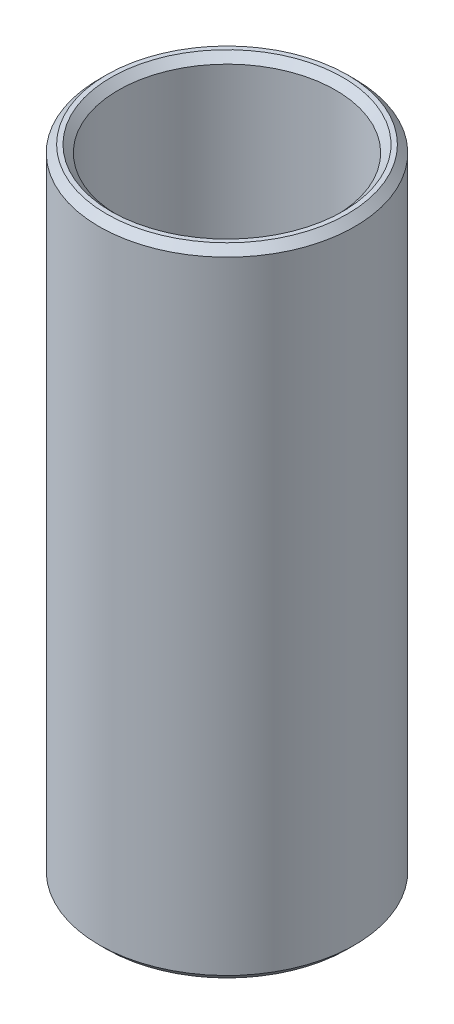
from build123d import *

# Parameters (mm, degrees)
SKETCH1_R           = 55
BOSS_EXTRUDE1_DEPTH = 273.943988282
SKETCH2_R           = 46.760833803
CUT_EXTRUDE1_DEPTH  = 285.772380536
CHAMFER1_SIZE       = 3.151265274


with BuildPart() as part:
    # Sketch1 → Boss-Extrude1 (new body)
    with BuildSketch(Plane(origin=(0, 0, 0), x_dir=(1, 0, 0), z_dir=(0, 1, 0))):
        Circle(SKETCH1_R)
    extrude(amount=BOSS_EXTRUDE1_DEPTH)

    # Sketch2 → Cut-Extrude1 (cut, through all)
    with BuildSketch(Plane(origin=(0, 0, 0), x_dir=(1, 0, 0), z_dir=(0, 1, 0))):
        Circle(SKETCH2_R)
    extrude(amount=CUT_EXTRUDE1_DEPTH, mode=Mode.SUBTRACT)

    # Chamfer1
    chamfer1_edges = [part.edges().sort_by_distance(p)[0] for p in [
        (-46.760833803, 273.943988282, 0),
        (-46.760833803, 0, 0),
        (-55, 0, 0),
        (-55, 273.943988282, 0),
    ]]
    chamfer(chamfer1_edges, length=CHAMFER1_SIZE)


solid = part.part
